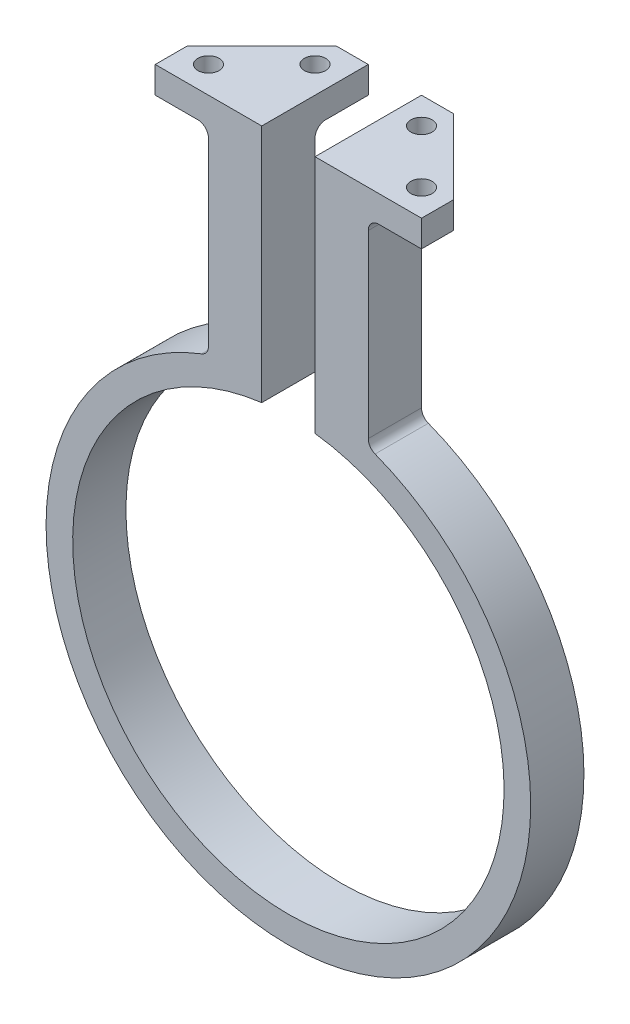
from build123d import *
from OCP.BRepFilletAPI import BRepFilletAPI_MakeChamfer

# Parameters (mm, degrees)
BOSS_EXTRUDE1_DEPTH = 12.7
SKETCH2_W           = 25.4
SKETCH2_H           = 25.4
SKETCH2_R           = 2.54
BOSS_EXTRUDE2_DEPTH = 6.35
CHAMFER2_SIZE       = 1.27
CHAMFER2_SIZE2      = 1.103994157
CHAMFER3_SIZE       = 17.78
FILLET3_R           = 2.54


with BuildPart() as part:
    # Sketch1 → Boss-Extrude1 (new body)
    with BuildSketch(Plane.XY):
        with BuildLine():
            Line((-6.35, 51.041519619), (-6.35, 101.841519619))
            Line((-6.35, 101.841519619), (-19.05, 101.841519619))
            Line((-19.05, 101.841519619), (-19.05, 54.554593986))
            ThreePointArc((-19.05, 54.554593986), (0, -57.785), (19.05, 54.554593986))
            Line((19.05, 54.554593986), (19.05, 101.841519619))
            Line((19.05, 101.841519619), (6.35, 101.841519619))
            Line((6.35, 101.841519619), (6.35, 51.041519619))
            ThreePointArc((6.35, 51.041519619), (0, -51.435), (-6.35, 51.041519619))
        make_face()
    extrude(amount=BOSS_EXTRUDE1_DEPTH)

    # Sketch2 → Boss-Extrude2 (add)
    with BuildSketch(Plane(origin=(0, 101.841519619, 0), x_dir=(1, 0, 0), z_dir=(0, 1, 0))):
        with Locations((-19.05, 0)):
            Rectangle(SKETCH2_W, SKETCH2_H)
        with Locations(Location((-25.4, -6.35, 0), (0, 0, 270))):
            Circle(SKETCH2_R, mode=Mode.SUBTRACT)
        with Locations(Location((-12.7, 6.35, 0), (0, 0, 270))):
            Circle(SKETCH2_R, mode=Mode.SUBTRACT)
    boss_extrude2 = extrude(amount=BOSS_EXTRUDE2_DEPTH)

    # Mirror5: Boss-Extrude2 across plane
    add(boss_extrude2.mirror(Plane(origin=(0, 0, 0), x_dir=(0, 0, 1), z_dir=(1, 0, 0))))

    # Chamfer2: one chamfer whose edges measure the first distance from different faces: ONE call of the kernel's chamfer builder (chamfer() names one face for all edges)
    chamfer2_edges_1 = [part.edges().sort_by_distance(p)[0] for p in [
        (-12.7, 101.841519619, -8.89),
    ]]
    chamfer2_side_1 = [part.faces().sort_by_distance(p)[0] for p in [
        (-12.7, 105.016519619, -8.89),
    ]]
    chamfer2_edges_2 = [part.edges().sort_by_distance(p)[0] for p in [
        (-25.4, 101.841519619, 3.81),
    ]]
    chamfer2_side_2 = [part.faces().sort_by_distance(p)[0] for p in [
        (-25.4, 105.016519619, 3.81),
    ]]
    chamfer2_edges_3 = [part.edges().sort_by_distance(p)[0] for p in [
        (12.7, 101.841519619, -8.89),
        (25.4, 101.841519619, 3.81),
    ]]
    chamfer2_side_3 = [part.faces().sort_by_distance(p)[0] for p in [
        (21.360206035, 101.841519619, -2.310206035),
    ]]
    chamfer2 = BRepFilletAPI_MakeChamfer(part.part.solid().wrapped)
    for e in chamfer2_edges_1:
        chamfer2.Add(CHAMFER2_SIZE, CHAMFER2_SIZE2, e.wrapped, chamfer2_side_1[0].wrapped)  # the first distance lies on this face
    for e in chamfer2_edges_2:
        chamfer2.Add(CHAMFER2_SIZE, CHAMFER2_SIZE2, e.wrapped, chamfer2_side_2[0].wrapped)  # the first distance lies on this face
    for e in chamfer2_edges_3:
        chamfer2.Add(CHAMFER2_SIZE, CHAMFER2_SIZE2, e.wrapped, chamfer2_side_3[0].wrapped)  # the first distance lies on this face
    add(Compound.cast(chamfer2.Shape()), mode=Mode.REPLACE)

    # Chamfer3
    chamfer3_edges = [part.edges().sort_by_distance(p)[0] for p in [
        (-31.75, 105.016519619, -12.7),
        (31.75, 105.016519619, -12.7),
    ]]
    chamfer(chamfer3_edges, length=CHAMFER3_SIZE)

    # Fillet3
    fillet3_edges = [part.edges().sort_by_distance(p)[0] for p in [
        (12.7, 101.841519619, 0),
        (-19.05, 54.554593986, 6.35),
        (-19.05, 101.841519619, 6.35),
        (19.05, 101.841519619, 6.35),
        (19.05, 54.554593986, 6.35),
        (-12.7, 101.841519619, 0),
    ]]
    fillet(fillet3_edges, radius=FILLET3_R - 0.0001)  # a hair under: the kernel refuses the full size


solid = part.part
